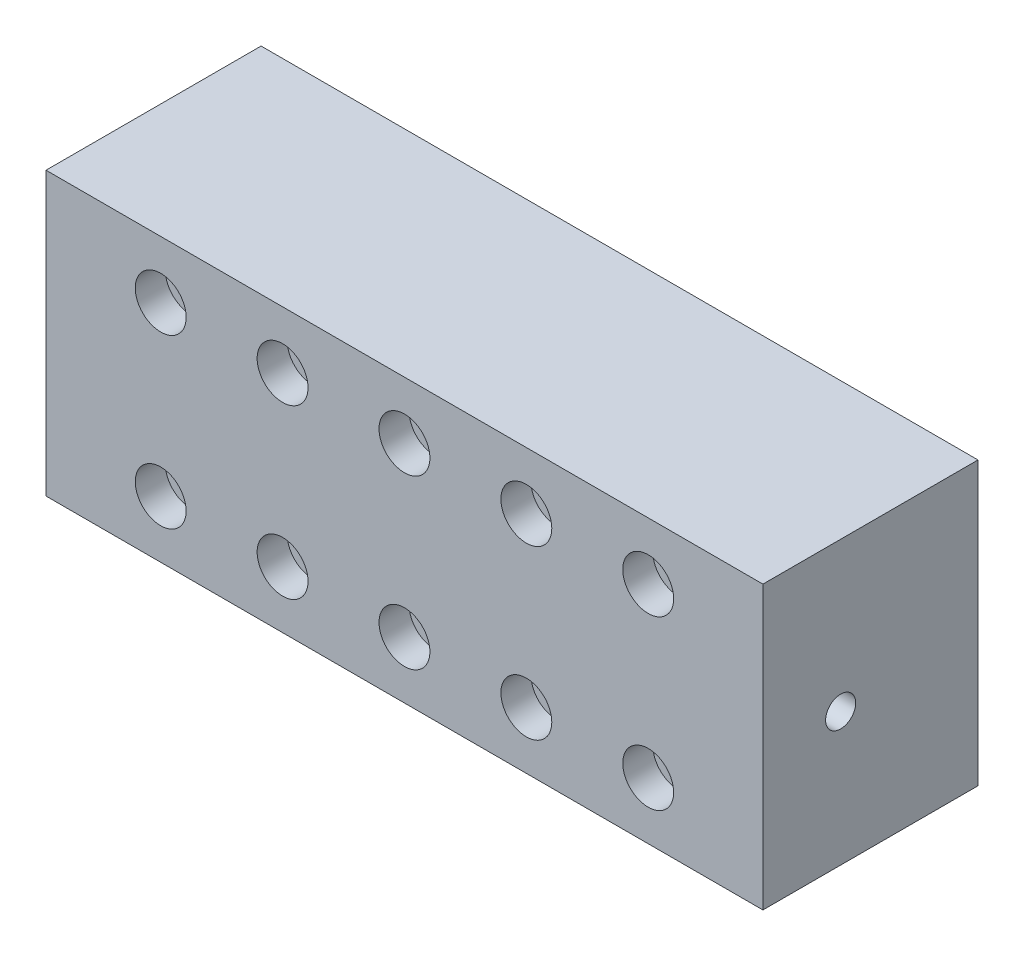
from build123d import *

# Parameters (mm, degrees)
SKIZZE2_W                            = 100
SKIZZE2_H                            = 39.364160046
AUFSATZ_LINEAR_AUSTRAGEN1_DEPTH      = 30
SCHNITT_LINEAR_AUSTRAGEN1_DEPTH      = 40
SCHNITT_LINEAR_AUSTRAGEN1_DEPTH_BACK = 40
SKIZZE10_R                           = 5
SKIZZE17_R                           = 1.55
SCHNITT_LINEAR_AUSTRAGEN2_DEPTH      = 9.1
SKIZZE24_R                           = 2.05
SCHNITT_LINEAR_AUSTRAGEN4_DEPTH      = 112.577493681
SKIZZE41_R                           = 3.55
SCHNITT_LINEAR_AUSTRAGEN11_DEPTH     = 4.2
LINEARES_MUSTER5_COUNT               = 5
LINEARES_MUSTER5_PITCH               = 17
SPIEGELN9_COPY_1_SKETCH_R            = 3.55
SPIEGELN9_COPY_1_DEPTH               = 4.2
SPIEGELN9_COPY_2_SKETCH_R            = 3.55
SPIEGELN9_COPY_2_DEPTH               = 4.2
SPIEGELN9_COPY_3_SKETCH_R            = 3.55
SPIEGELN9_COPY_3_DEPTH               = 4.2
SPIEGELN9_COPY_4_SKETCH_R            = 3.55
SPIEGELN9_COPY_4_DEPTH               = 4.2
SPIEGELN9_COPY_5_SKETCH_R            = 3.55
SPIEGELN9_COPY_5_DEPTH               = 4.2
SKIZZE28_W                           = 7.1
SKIZZE28_H                           = 3.3
SCHNITT_LINEAR_AUSTRAGEN5_DEPTH      = 7.96
SCHNITT_LINEAR_AUSTRAGEN8_DEPTH      = 1.65
LINEARES_MUSTER3_COUNT               = 5
LINEARES_MUSTER3_PITCH               = 17
LINEARES_MUSTER4_COUNT               = 5
LINEARES_MUSTER4_PITCH               = 17
SPIEGELN7_COPY_1_DEPTH               = 1.65
SPIEGELN7_COPY_2_DEPTH               = 1.65
SPIEGELN7_COPY_3_DEPTH               = 1.65
SPIEGELN7_COPY_4_DEPTH               = 1.65
SPIEGELN7_COPY_5_DEPTH               = 1.65
SPIEGELN8_COPY_1_SKETCH_W            = 7.1
SPIEGELN8_COPY_1_SKETCH_H            = 3.3
SPIEGELN8_COPY_1_DEPTH               = 7.96
SPIEGELN8_COPY_2_SKETCH_W            = 7.1
SPIEGELN8_COPY_2_SKETCH_H            = 3.3
SPIEGELN8_COPY_2_DEPTH               = 7.96
SPIEGELN8_COPY_3_SKETCH_W            = 7.1
SPIEGELN8_COPY_3_SKETCH_H            = 3.3
SPIEGELN8_COPY_3_DEPTH               = 7.96
SPIEGELN8_COPY_4_SKETCH_W            = 7.1
SPIEGELN8_COPY_4_SKETCH_H            = 3.3
SPIEGELN8_COPY_4_DEPTH               = 7.96
SPIEGELN8_COPY_5_SKETCH_W            = 7.1
SPIEGELN8_COPY_5_SKETCH_H            = 3.3
SPIEGELN8_COPY_5_DEPTH               = 7.96
SKIZZE37_R                           = 0.5
SCHNITT_LINEAR_AUSTRAGEN9_DEPTH      = 112.577493681
SKIZZE40_R                           = 2.1
SCHNITT_LINEAR_AUSTRAGEN10_DEPTH     = 6


with BuildPart() as part:
    # Skizze2 → Aufsatz-Linear austragen1 (new body)
    with BuildSketch(Plane.XY):
        with Locations((50, 19.682080023)):
            Rectangle(SKIZZE2_W, SKIZZE2_H)
    extrude(amount=AUFSATZ_LINEAR_AUSTRAGEN1_DEPTH)

    # Skizze10 → Schnitt-Linear austragen1 (cut, two sides: drawn at the far end of the back side and taken through both)
    with BuildSketch(Plane.ZY.offset(-50).offset(-SCHNITT_LINEAR_AUSTRAGEN1_DEPTH_BACK)):
        with Locations((14.945770016, 20.027045739)):
            Circle(SKIZZE10_R)
    extrude(amount=SCHNITT_LINEAR_AUSTRAGEN1_DEPTH + SCHNITT_LINEAR_AUSTRAGEN1_DEPTH_BACK, mode=Mode.SUBTRACT)

    # Skizze17 → Schnitt-Linear austragen2 (cut)
    with BuildSketch(Plane.ZY.offset(-90)):
        with Locations((14.945770016, 20.027045739)):
            Circle(SKIZZE17_R)
    schnitt_linear_austragen2 = extrude(amount=-SCHNITT_LINEAR_AUSTRAGEN2_DEPTH, mode=Mode.SUBTRACT)

    # Spiegeln1: Schnitt-Linear austragen2 across plane
    add(schnitt_linear_austragen2.mirror(Plane.ZY.offset(-50)), mode=Mode.SUBTRACT)

    # Skizze24 → Schnitt-Linear austragen4 (cut, through all)
    with BuildSketch(Plane.XY.offset(30)):
        with Locations((16, 31.364160046)):
            Circle(SKIZZE24_R)
        with Locations((33, 31.364160046)):
            Circle(SKIZZE24_R)
        with Locations((50, 31.364160046)):
            Circle(SKIZZE24_R)
        with Locations((67, 31.364160046)):
            Circle(SKIZZE24_R)
        with Locations((84, 31.364160046)):
            Circle(SKIZZE24_R)
    schnitt_linear_austragen4 = extrude(amount=-SCHNITT_LINEAR_AUSTRAGEN4_DEPTH, mode=Mode.SUBTRACT)

    # Spiegeln4: Schnitt-Linear austragen4 across plane
    add(schnitt_linear_austragen4.mirror(Plane.ZX.offset(19.664160046)), mode=Mode.SUBTRACT)

    # Skizze41 → Schnitt-Linear austragen11 (cut)
    with BuildSketch(Plane.XY.offset(30)):
        with Locations((16, 31.364160046)):
            Circle(SKIZZE41_R)
    schnitt_linear_austragen11 = extrude(amount=-SCHNITT_LINEAR_AUSTRAGEN11_DEPTH, mode=Mode.SUBTRACT)

    # Lineares Muster5: Schnitt-Linear austragen11 ×5
    with Locations(*[(i * LINEARES_MUSTER5_PITCH, 0, 0) for i in range(1, LINEARES_MUSTER5_COUNT)]):
        add(schnitt_linear_austragen11, mode=Mode.SUBTRACT)

    # Spiegeln9 copy 1 sketch → Spiegeln9 copy 1 (cut)
    with BuildSketch(Plane(origin=(17, 39.328320093, 30), x_dir=(1, 0, 0), z_dir=(0, 0, 1))):
        with Locations((16, -31.364160046)):
            Circle(SPIEGELN9_COPY_1_SKETCH_R)
    extrude(amount=-SPIEGELN9_COPY_1_DEPTH, mode=Mode.SUBTRACT)

    # Spiegeln9 copy 2 sketch → Spiegeln9 copy 2 (cut)
    with BuildSketch(Plane(origin=(34, 39.328320093, 30), x_dir=(1, 0, 0), z_dir=(0, 0, 1))):
        with Locations((16, -31.364160046)):
            Circle(SPIEGELN9_COPY_2_SKETCH_R)
    extrude(amount=-SPIEGELN9_COPY_2_DEPTH, mode=Mode.SUBTRACT)

    # Spiegeln9 copy 3 sketch → Spiegeln9 copy 3 (cut)
    with BuildSketch(Plane(origin=(51, 39.328320093, 30), x_dir=(1, 0, 0), z_dir=(0, 0, 1))):
        with Locations((16, -31.364160046)):
            Circle(SPIEGELN9_COPY_3_SKETCH_R)
    extrude(amount=-SPIEGELN9_COPY_3_DEPTH, mode=Mode.SUBTRACT)

    # Spiegeln9 copy 4 sketch → Spiegeln9 copy 4 (cut)
    with BuildSketch(Plane(origin=(68, 39.328320093, 30), x_dir=(1, 0, 0), z_dir=(0, 0, 1))):
        with Locations((16, -31.364160046)):
            Circle(SPIEGELN9_COPY_4_SKETCH_R)
    extrude(amount=-SPIEGELN9_COPY_4_DEPTH, mode=Mode.SUBTRACT)

    # Spiegeln9 copy 5 sketch → Spiegeln9 copy 5 (cut)
    with BuildSketch(Plane(origin=(0, 39.328320093, 30), x_dir=(1, 0, 0), z_dir=(0, 0, 1))):
        with Locations((16, -31.364160046)):
            Circle(SPIEGELN9_COPY_5_SKETCH_R)
    extrude(amount=-SPIEGELN9_COPY_5_DEPTH, mode=Mode.SUBTRACT)

    # Skizze28 → Schnitt-Linear austragen5 (cut)
    with BuildSketch(Plane(origin=(0, 0, 0), x_dir=(-1, 0, 0), z_dir=(0, -1, 0))):
        with Locations((-16, -8.415336397)):
            Rectangle(SKIZZE28_W, SKIZZE28_H)
    schnitt_linear_austragen5 = extrude(amount=-SCHNITT_LINEAR_AUSTRAGEN5_DEPTH, mode=Mode.SUBTRACT)

    # Skizze34 → Schnitt-Linear austragen8 (cut, symmetric)
    with BuildSketch(Plane(origin=(0, 0, 8.4), x_dir=(-1, 0, 0), z_dir=(0, 0, -1))):
        Polygon((-16, 12.005611931), (-19.5, 9.984885989), (-19.5, 5.943434104), (-16, 3.922708162), (-12.5, 5.943434104), (-12.5, 9.984885989), align=None)
    schnitt_linear_austragen8 = extrude(amount=SCHNITT_LINEAR_AUSTRAGEN8_DEPTH, both=True, mode=Mode.SUBTRACT)

    # Lineares Muster3: Schnitt-Linear austragen8 ×5
    with Locations(*[(i * LINEARES_MUSTER3_PITCH, 0, 0) for i in range(1, LINEARES_MUSTER3_COUNT)]):
        add(schnitt_linear_austragen8, mode=Mode.SUBTRACT)

    # Lineares Muster4: Schnitt-Linear austragen5 ×5
    with Locations(*[(i * LINEARES_MUSTER4_PITCH, 0, 0) for i in range(1, LINEARES_MUSTER4_COUNT)]):
        add(schnitt_linear_austragen5, mode=Mode.SUBTRACT)

    # Spiegeln6: Schnitt-Linear austragen8 across plane
    add(schnitt_linear_austragen8.mirror(Plane.ZX.offset(19.664160046)), mode=Mode.SUBTRACT)

    # Spiegeln7 copy 1 sketch → Spiegeln7 copy 1 (cut, symmetric)
    with BuildSketch(Plane(origin=(17, 39.328320093, 8.4), x_dir=(-1, 0, 0), z_dir=(0, 0, -1))):
        Polygon((-16, -12.005611931), (-19.5, -9.984885989), (-19.5, -5.943434104), (-16, -3.922708162), (-12.5, -5.943434104), (-12.5, -9.984885989), align=None)
    extrude(amount=SPIEGELN7_COPY_1_DEPTH, both=True, mode=Mode.SUBTRACT)

    # Spiegeln7 copy 2 sketch → Spiegeln7 copy 2 (cut, symmetric)
    with BuildSketch(Plane(origin=(34, 39.328320093, 8.4), x_dir=(-1, 0, 0), z_dir=(0, 0, -1))):
        Polygon((-16, -12.005611931), (-19.5, -9.984885989), (-19.5, -5.943434104), (-16, -3.922708162), (-12.5, -5.943434104), (-12.5, -9.984885989), align=None)
    extrude(amount=SPIEGELN7_COPY_2_DEPTH, both=True, mode=Mode.SUBTRACT)

    # Spiegeln7 copy 3 sketch → Spiegeln7 copy 3 (cut, symmetric)
    with BuildSketch(Plane(origin=(51, 39.328320093, 8.4), x_dir=(-1, 0, 0), z_dir=(0, 0, -1))):
        Polygon((-16, -12.005611931), (-19.5, -9.984885989), (-19.5, -5.943434104), (-16, -3.922708162), (-12.5, -5.943434104), (-12.5, -9.984885989), align=None)
    extrude(amount=SPIEGELN7_COPY_3_DEPTH, both=True, mode=Mode.SUBTRACT)

    # Spiegeln7 copy 4 sketch → Spiegeln7 copy 4 (cut, symmetric)
    with BuildSketch(Plane(origin=(68, 39.328320093, 8.4), x_dir=(-1, 0, 0), z_dir=(0, 0, -1))):
        Polygon((-16, -12.005611931), (-19.5, -9.984885989), (-19.5, -5.943434104), (-16, -3.922708162), (-12.5, -5.943434104), (-12.5, -9.984885989), align=None)
    extrude(amount=SPIEGELN7_COPY_4_DEPTH, both=True, mode=Mode.SUBTRACT)

    # Spiegeln7 copy 5 sketch → Spiegeln7 copy 5 (cut, symmetric)
    with BuildSketch(Plane(origin=(0, 39.328320093, 8.4), x_dir=(-1, 0, 0), z_dir=(0, 0, -1))):
        Polygon((-16, -12.005611931), (-19.5, -9.984885989), (-19.5, -5.943434104), (-16, -3.922708162), (-12.5, -5.943434104), (-12.5, -9.984885989), align=None)
    extrude(amount=SPIEGELN7_COPY_5_DEPTH, both=True, mode=Mode.SUBTRACT)

    # Spiegeln8 copy 1 sketch → Spiegeln8 copy 1 (cut)
    with BuildSketch(Plane(origin=(17, 39.328320093, 0), x_dir=(-1, 0, 0), z_dir=(0, 1, 0))):
        with Locations((-16, 8.415336397)):
            Rectangle(SPIEGELN8_COPY_1_SKETCH_W, SPIEGELN8_COPY_1_SKETCH_H)
    extrude(amount=-SPIEGELN8_COPY_1_DEPTH, mode=Mode.SUBTRACT)

    # Spiegeln8 copy 2 sketch → Spiegeln8 copy 2 (cut)
    with BuildSketch(Plane(origin=(34, 39.328320093, 0), x_dir=(-1, 0, 0), z_dir=(0, 1, 0))):
        with Locations((-16, 8.415336397)):
            Rectangle(SPIEGELN8_COPY_2_SKETCH_W, SPIEGELN8_COPY_2_SKETCH_H)
    extrude(amount=-SPIEGELN8_COPY_2_DEPTH, mode=Mode.SUBTRACT)

    # Spiegeln8 copy 3 sketch → Spiegeln8 copy 3 (cut)
    with BuildSketch(Plane(origin=(51, 39.328320093, 0), x_dir=(-1, 0, 0), z_dir=(0, 1, 0))):
        with Locations((-16, 8.415336397)):
            Rectangle(SPIEGELN8_COPY_3_SKETCH_W, SPIEGELN8_COPY_3_SKETCH_H)
    extrude(amount=-SPIEGELN8_COPY_3_DEPTH, mode=Mode.SUBTRACT)

    # Spiegeln8 copy 4 sketch → Spiegeln8 copy 4 (cut)
    with BuildSketch(Plane(origin=(68, 39.328320093, 0), x_dir=(-1, 0, 0), z_dir=(0, 1, 0))):
        with Locations((-16, 8.415336397)):
            Rectangle(SPIEGELN8_COPY_4_SKETCH_W, SPIEGELN8_COPY_4_SKETCH_H)
    extrude(amount=-SPIEGELN8_COPY_4_DEPTH, mode=Mode.SUBTRACT)

    # Spiegeln8 copy 5 sketch → Spiegeln8 copy 5 (cut)
    with BuildSketch(Plane(origin=(0, 39.328320093, 0), x_dir=(-1, 0, 0), z_dir=(0, 1, 0))):
        with Locations((-16, 8.415336397)):
            Rectangle(SPIEGELN8_COPY_5_SKETCH_W, SPIEGELN8_COPY_5_SKETCH_H)
    extrude(amount=-SPIEGELN8_COPY_5_DEPTH, mode=Mode.SUBTRACT)

    # Skizze37 → Schnitt-Linear austragen9 (cut, through all)
    with BuildSketch(Plane(origin=(100, 0, 0), x_dir=(0, 0, -1), z_dir=(1, 0, 0))):
        with Locations((-19.158756707, 18.550923217)):
            Circle(SKIZZE37_R)
    extrude(amount=-SCHNITT_LINEAR_AUSTRAGEN9_DEPTH, mode=Mode.SUBTRACT)

    # Skizze40 → Schnitt-Linear austragen10 (cut)
    with BuildSketch(Plane(origin=(100, 0, 0), x_dir=(0, 0, -1), z_dir=(1, 0, 0))):
        with Locations((-19.158756707, 18.550923217)):
            Circle(SKIZZE40_R)
    extrude(amount=-SCHNITT_LINEAR_AUSTRAGEN10_DEPTH, mode=Mode.SUBTRACT)


solid = part.part
